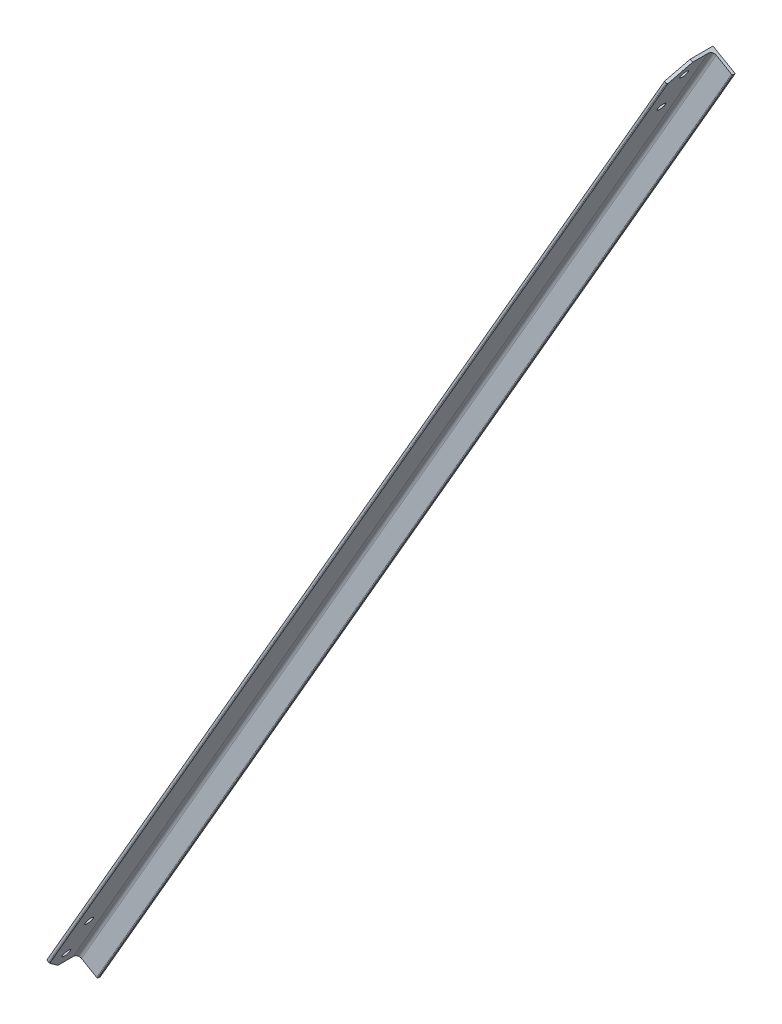
from build123d import *

# Parameters (mm, degrees)
F_70X45X5_1_DEPTH   = 2230
CUT_EXTRUDE_1_REACH = 2252.827
SKETCH_12_R         = 7
CUT_EXTRUDE_2_REACH = 2252.827
SKETCH_13_R         = 7
CHAMFER_1_SIZE      = 30
CHAMFER_2_SIZE      = 30


with BuildPart() as part:
    # 草图11 → 不等边角钢 70X45X5(1) (new body)
    with BuildSketch(Plane(origin=(1115, 1931.236650439, 0), x_dir=(0.86602540378444, -0.49999999999999784, 0), z_dir=(-0.49999999999999784, -0.86602540378444, 0))):
        with BuildLine():
            Line((0, 70), (0, 0))
            Line((0, 0), (45, 0))
            Line((45, 0), (45, 3.33))
            ThreePointArc((45, 3.33), (44.510868325, 4.510868325), (43.33, 5))
            Line((43.33, 5), (12.5, 5))
            ThreePointArc((12.5, 5), (7.196699141, 7.196699141), (5, 12.5))
            Line((5, 12.5), (5, 68.33))
            ThreePointArc((5, 68.33), (4.510868325, 69.510868325), (3.33, 70))
            Line((3.33, 70), (0, 70))
        make_face()
    extrude(amount=F_70X45X5_1_DEPTH)

    # 草图12 → 切除-拉伸1 (cut, up to next)
    with BuildSketch(Plane(origin=(0, 0, 0), x_dir=(0, 0, 1), z_dir=(-0.86602540378444, 0.49999999999999784, 0)), mode=Mode.PRIVATE) as cut_extrude_1_sk1:
        with Locations(Location((40, 30, 0), (0, 0, 270))):
            Circle(SKETCH_12_R)
    cut_extrude_1_tool1 = extrude(cut_extrude_1_sk1.sketch, amount=-CUT_EXTRUDE_1_REACH, mode=Mode.PRIVATE) & part.part
    # 草图12 → 切除-拉伸1 (cut, up to next)
    with BuildSketch(Plane(origin=(0, 0, 0), x_dir=(0, 0, 1), z_dir=(-0.86602540378444, 0.49999999999999784, 0)), mode=Mode.PRIVATE) as cut_extrude_1_sk2:
        with Locations(Location((40, 110, 0), (0, 0, 270))):
            Circle(SKETCH_12_R)
    cut_extrude_1_tool2 = extrude(cut_extrude_1_sk2.sketch, amount=-CUT_EXTRUDE_1_REACH, mode=Mode.PRIVATE) & part.part
    add(cut_extrude_1_tool1.solids().sort_by_distance((15, 25.980762, 40))[0], mode=Mode.SUBTRACT)
    add(cut_extrude_1_tool2.solids().sort_by_distance((55, 95.262794, 40))[0], mode=Mode.SUBTRACT)

    # 草图13 → 切除-拉伸2 (cut, up to next)
    with BuildSketch(Plane(origin=(0, 0, 0), x_dir=(0, 0, 1), z_dir=(-0.86602540378444, 0.49999999999999784, 0)), mode=Mode.PRIVATE) as cut_extrude_2_sk1:
        with Locations(Location((40.004723234, 2120, 0), (0, 0, 270))):
            Circle(SKETCH_13_R)
    cut_extrude_2_tool1 = extrude(cut_extrude_2_sk1.sketch, amount=-CUT_EXTRUDE_2_REACH, mode=Mode.PRIVATE) & part.part
    # 草图13 → 切除-拉伸2 (cut, up to next)
    with BuildSketch(Plane(origin=(0, 0, 0), x_dir=(0, 0, 1), z_dir=(-0.86602540378444, 0.49999999999999784, 0)), mode=Mode.PRIVATE) as cut_extrude_2_sk2:
        with Locations(Location((40.004723234, 2200, 0), (0, 0, 270))):
            Circle(SKETCH_13_R)
    cut_extrude_2_tool2 = extrude(cut_extrude_2_sk2.sketch, amount=-CUT_EXTRUDE_2_REACH, mode=Mode.PRIVATE) & part.part
    add(cut_extrude_2_tool1.solids().sort_by_distance((1060, 1835.973856, 40.004723))[0], mode=Mode.SUBTRACT)
    add(cut_extrude_2_tool2.solids().sort_by_distance((1100, 1905.255888, 40.004723))[0], mode=Mode.SUBTRACT)

    # 倒角1
    # the kernel refuses this chamfer: 30 mm, written as the material it takes off along each edge
    with BuildSketch(Plane(origin=(1184.698148536, 1890.99640562, 70), x_dir=(-0.49981095845564616, -0.8656979742248816, 0.02749587661058632), z_dir=(-0.86602540378444, 0.49999999999999784, 0))) as chamfer_1_piece_1:
        Polygon((CHAMFER_1_SIZE * 0.999621916911, -CHAMFER_1_SIZE * 0.0274958766106), (-CHAMFER_1_SIZE * 0.0274958766106, -CHAMFER_1_SIZE * 0.999621916911), (0, 0), align=None)
    extrude(amount=157.630979278, mode=Mode.SUBTRACT)

    # 倒角2
    # the kernel refuses this chamfer: 30 mm, written as the material it takes off along each edge
    with BuildSketch(Plane(origin=(69.698148536, -40.240244819, 70), x_dir=(-0.013747938305293054, -0.023812127644090075, -0.9996219169112966), z_dir=(-0.86602540378444, 0.49999999999999784, 0))) as chamfer_2_piece_1:
        Polygon((CHAMFER_2_SIZE * 0.999621916911, -CHAMFER_2_SIZE * 0.0274958766106), (-CHAMFER_2_SIZE * 0.0274958766106, -CHAMFER_2_SIZE * 0.999621916911), (0, 0), align=None)
    extrude(amount=157.630979278, mode=Mode.SUBTRACT)


solid = part.part
